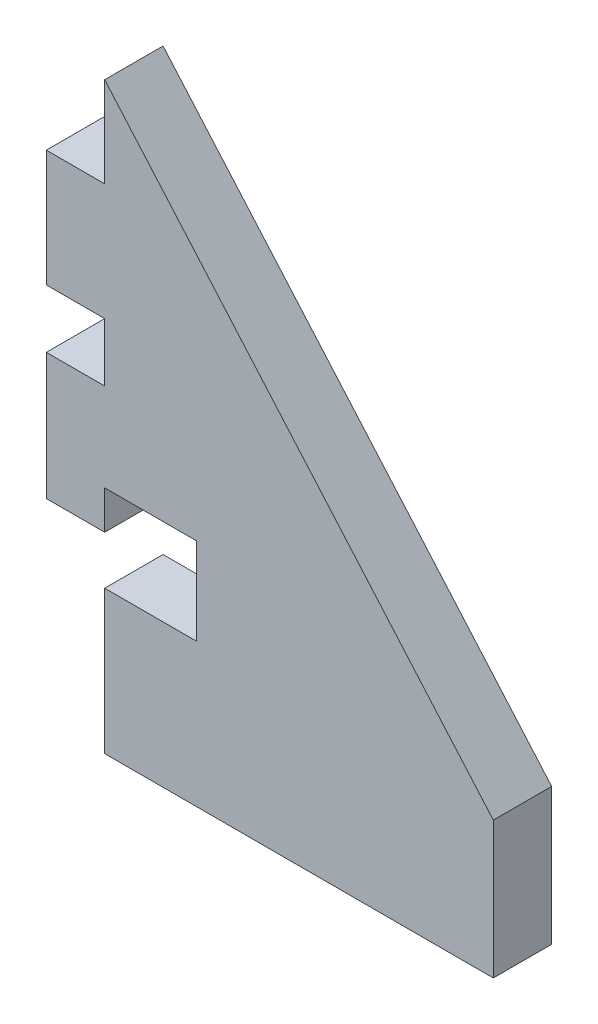
from build123d import *

# Parameters (mm, degrees)
BOSS_EXTRUDE1_DEPTH = 6.35


with BuildPart() as part:
    # Sketch1 → Boss-Extrude1 (new body)
    with BuildSketch(Plane.XY):
        Polygon((-12.346676125, 38.1), (-18.696676125, 38.1), (-18.696676125, 25.4), (-12.346676125, 25.4), (-12.346676125, 19.05), (-18.696676125, 19.05), (-18.696676125, 5.2705), (-12.346676125, 5.2705), (-12.346676125, 9.455763351), (-2.346676125, 9.455763351), (-2.346676125, 5.2705), (-2.346676125, 0), (-12.346676125, 0), (-12.346676125, -15.5875), (29.935330231, -15.5875), (29.935330231, -0.710514446), (-12.346676125, 47.9125), align=None)
    extrude(amount=BOSS_EXTRUDE1_DEPTH)


solid = part.part
